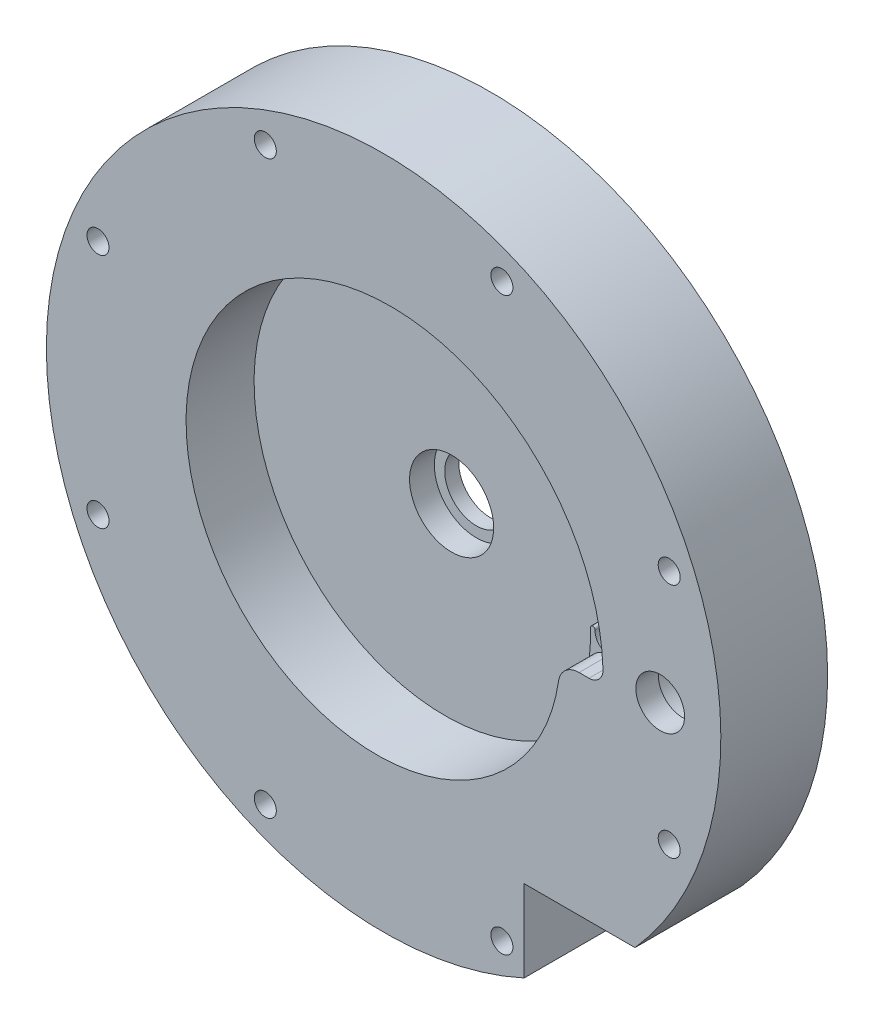
from build123d import *

# Parameters (mm, degrees)
VOLUTE_CUT_DEPTH      = 109.853225441
CAP_CUT_DEPTH         = 110.150134912
SKETCH28_W            = 25.046126628
SKETCH28_H            = 18.470321928
OUTLET_HOLE_CUT_DEPTH = 111.431593896
SKETCH26_R            = 2.4892
FASTENER_HOLE_DEPTH   = 111.431593896
FASTENER_HOLES_COUNT  = 8
CIRPATTERN1_COUNT     = 8


with BuildPart() as part:
    # Sketch22 → Main Body (revolve)
    with BuildSketch(Plane(origin=(0, 0, 0), x_dir=(1, 0, 0), z_dir=(0, 1, 0))):
        Polygon((-25.4, 0), (-9.5, 0), (-9.5, 5.588), (-7.14375, 5.588), (-7.14375, 8.763), (-76.2, 8.763), (-76.2, -15.367), (-25.4, -15.367), align=None)
    revolve(axis=Axis((0, 0, 0), (0, 0, -1)))

    # Sketch23 → Volute Cut (cut, through all)
    with BuildSketch(Plane.XY):
        with BuildLine():
            Line((44.166924028, -3.278948669), (46.409987281, -3.278948669))
            ThreePointArc((46.409987281, -3.278948669), (48.689668065, -2.311613487), (49.577995098, 0))
            add(Edge.make_bspline(
                [(39.939526111, 0), (39.942269446, -0.0837473), (39.947756723, -0.251260409), (39.954015699, -0.502616311), (39.958818633, -0.754058522), (39.965227666, -1.257271925), (39.961619732, -2.517021244), (39.875091851, -4.365243066), (39.649454652, -6.542756078), (39.33988264, -8.543760179), (38.929454388, -10.530211789), (38.418824768, -12.497026639), (37.808911738, -14.439148731), (37.100892119, -16.351564673), (36.296198826, -18.22931668), (35.396517359, -20.067515799), (34.403782101, -21.86135476), (33.320172005, -23.606120692), (32.148105775, -25.297207577), (30.890236459, -26.930128476), (29.549445458, -28.500527466), (28.128835965, -30.00419128), (26.631725823, -31.437060619), (25.061639825, -32.795241099), (23.422301466, -34.075013818), (21.717624168, -35.272845505), (19.951701985, -36.385398236), (18.128799822, -37.409538673), (16.253343185, -38.342346824), (14.329907485, -39.18112428), (12.363206918, -39.923401923), (10.358082955, -40.566947066), (8.319492465, -41.109770024), (6.2524955, -41.550130082), (4.162242776, -41.886540847), (2.053962868, -42.117774975), (-0.06705083, -42.242868254), (-2.195453363, -42.261123016), (-4.325861655, -42.172110902), (-6.452868085, -41.975674931), (-8.57105419, -41.671930888), (-10.675004435, -41.261268029), (-12.759320026, -40.744349078), (-14.818632734, -40.12210953), (-16.847618693, -39.395756259), (-18.841012126, -38.56676542), (-20.793618979, -37.636879662), (-22.700330424, -36.608104648), (-24.556136184, -35.482704889), (-26.356137661, -34.263198905), (-28.095560825, -32.952353715), (-29.769768833, -31.55317868), (-31.374274336, -30.068918699), (-32.904751456, -28.503046779), (-34.357047394, -26.859256), (-35.727193628, -25.141450883), (-37.011416693, -23.353738194), (-38.206148494, -21.500417195), (-39.308036131, -19.585969367), (-40.313951213, -17.615047632), (-41.220998633, -15.592465105), (-42.026524769, -13.523183384), (-42.728125112, -11.412300433), (-43.323651272, -9.265038062), (-43.811217363, -7.086729057), (-44.189205737, -4.882803972), (-44.45627205, -2.658777629), (-44.611349658, -0.420235354), (-44.653653307, 1.827181013), (-44.582682128, 4.077787306), (-44.398221909, 6.325871377), (-44.100346646, 8.56570756), (-43.689419363, 10.791571224), (-43.166092199, 12.997753372), (-42.531305754, 15.17857525), (-41.786287694, 17.328402935), (-40.932550626, 19.441661853), (-39.971889229, 21.5128512), (-38.906376662, 23.536558227), (-37.738360243, 25.507472342), (-36.470456415, 27.420399009), (-35.105545007, 29.270273394), (-33.646762806, 31.052173728), (-32.097496441, 32.761334351), (-30.461374618, 34.393158406), (-28.742259697, 35.943230135), (-26.94423865, 37.407326771), (-25.071613414, 38.781429964), (-23.128890663, 40.061736735), (-21.120771014, 41.244669906), (-19.052137713, 42.326888003), (-16.928044805, 43.305294581), (-14.753704833, 44.177046957), (-12.534476089, 44.939564331), (-10.275849449, 45.590535256), (-7.983434825, 46.127924454), (-5.662947262, 46.549978947), (-3.32019273, 46.855233489), (-0.961053623, 47.042515279), (1.408525976, 47.110947946), (3.782555248, 47.059954789), (6.155011749, 46.889261268), (8.519856664, 46.598896718), (10.871050148, 46.189195315), (13.202566726, 45.660796242), (15.5084107, 45.014643097), (17.782631543, 44.251982509), (20.019339221, 43.374361984), (22.21271942, 42.383626969), (24.357048618, 41.281917146), (26.446708992, 40.07166197), (28.476203094, 38.755575441), (30.440168269, 37.336650139), (32.333390787, 35.818150527), (34.150819627, 34.203605534), (35.887579905, 32.496800442), (37.53898589, 30.70176809), (39.100553583, 28.822779415), (40.568012821, 26.864333353), (41.937318874, 24.831146131), (43.204663511, 22.728139958), (44.366485495, 20.560431162), (45.419480476, 18.333317788), (46.360610274, 16.052266689), (47.187111503, 13.722900146), (47.896503526, 11.35098205), (48.486595709, 8.942403666), (48.955493971, 6.503169041), (49.272698681, 4.245159804), (49.431000562, 2.592939581), (49.496684411, 1.660906774), (49.521980456, 1.24612125), (49.539009606, 0.934823446), (49.554044624, 0.6233596), (49.56726265, 0.311747828), (49.574417371, 0.103923043), (49.577995098, 0)],
                knots=[0, 0, 0, 0, 0.000895368, 0.001790933, 0.002686696, 0.003582656, 0.00716847, 0.016146863, 0.023343889, 0.030553689, 0.037776306, 0.045011781, 0.052260149, 0.059521445, 0.0667957, 0.074082946, 0.08138321, 0.088696521, 0.096022905, 0.103362389, 0.110714996, 0.11808075, 0.125459676, 0.132851796, 0.140257131, 0.147675704, 0.155107535, 0.162552646, 0.170011055, 0.177482784, 0.184967851, 0.192466275, 0.199978075, 0.207503269, 0.215041875, 0.222593912, 0.230159396, 0.237738345, 0.245330775, 0.252936704, 0.260556148, 0.268189123, 0.275835645, 0.28349573, 0.291169394, 0.298856653, 0.306557521, 0.314272014, 0.322000147, 0.329741934, 0.337497391, 0.345266532, 0.35304937, 0.360845922, 0.368656199, 0.376480218, 0.384317991, 0.392169531, 0.400034854, 0.407913972, 0.415806898, 0.423713647, 0.43163423, 0.439568662, 0.447516954, 0.455479121, 0.463455174, 0.471445127, 0.479448991, 0.48746678, 0.495498506, 0.503544181, 0.511603818, 0.519677428, 0.527765023, 0.535866616, 0.543982219, 0.552111843, 0.5602555, 0.568413202, 0.57658496, 0.584770787, 0.592970693, 0.60118469, 0.609412789, 0.617655002, 0.625911339, 0.634181813, 0.642466433, 0.650765212, 0.65907816, 0.667405288, 0.675746607, 0.684102128, 0.692471861, 0.700855818, 0.709254008, 0.717666443, 0.726093134, 0.734534089, 0.742989321, 0.75145884, 0.759942655, 0.768440778, 0.776953218, 0.785479986, 0.794021092, 0.802576546, 0.811146358, 0.819730538, 0.828329097, 0.836942043, 0.845569388, 0.854211141, 0.862867312, 0.87153791, 0.880222946, 0.888922429, 0.89763637, 0.906364776, 0.915107659, 0.923865028, 0.932636892, 0.94142326, 0.950224144, 0.959039551, 0.967869491, 0.976713973, 0.985573008, 0.992226839, 0.994446604, 0.995556828, 0.996667279, 0.997777958, 0.998888865, 1, 1, 1, 1], degree=3))
            ThreePointArc((39.939526111, 0), (40.466576111, 0.544597432), (40.993626111, 0))
            ThreePointArc((40.993626111, 0), (41.885404576, -2.31195546), (44.166924028, -3.278948669))
        make_face()
    extrude(amount=VOLUTE_CUT_DEPTH, mode=Mode.SUBTRACT)

    # Sketch25 → Cap Cut (cut, through all)
    with BuildSketch(Plane.XY.offset(8.58266)):
        with BuildLine():
            ThreePointArc((39.530232145, -7.279976568), (41.104770543, -4.417482526), (44.166924028, -3.278948669))
            ThreePointArc((44.166924028, -3.278948669), (41.885404576, -2.31195546), (40.993626111, 0))
            ThreePointArc((40.993626111, 0), (40.466576111, 0.544597432), (39.939526111, 0))
            add(Edge.make_bspline(
                [(39.530232145, -7.279976568), (39.566715351, -7.033442985), (39.69332497, -6.119385335), (39.875091851, -4.365243066), (39.961619732, -2.517021244), (39.965227666, -1.257271925), (39.958818633, -0.754058522), (39.954015699, -0.502616311), (39.947756723, -0.251260409), (39.942269446, -0.0837473), (39.939526111, 0)],
                knots=[0.973993066, 0.973993066, 0.973993066, 0.973993066, 0.976656111, 0.983853137, 0.99283153, 0.996417344, 0.997313304, 0.998209067, 0.999104632, 1, 1, 1, 1], degree=3))
        make_face()
    extrude(amount=CAP_CUT_DEPTH, mode=Mode.SUBTRACT)

    # Sketch28 → Outlet Hole Cut (cut, through all)
    with BuildSketch(Plane.XY.offset(15.367)):
        with Locations((44.273063314, -60.035160964)):
            Rectangle(SKETCH28_W, SKETCH28_H)
    extrude(amount=-OUTLET_HOLE_CUT_DEPTH, mode=Mode.SUBTRACT)

    # Sketch26 → Fastener Hole (cut, through all)
    with BuildSketch(Plane.XY.offset(15.367)):
        with Locations((64.532985346, -26.730437751)):
            Circle(SKETCH26_R)
    fastener_hole = extrude(amount=-FASTENER_HOLE_DEPTH, mode=Mode.SUBTRACT)

    # Fastener Holes: Fastener Hole ×8 about axis
    fastener_holes_axis = Axis((0, 0, 0), (0, 0, 1))
    for i in range(1, FASTENER_HOLES_COUNT):
        add(fastener_hole.rotate(fastener_holes_axis, i * 360 / FASTENER_HOLES_COUNT), mode=Mode.SUBTRACT)

    # Sketch27 → Turbine Shaft Hole (revolve, cut)
    with BuildSketch(Plane.ZX):
        Polygon((15.367, 62.5), (-8.763, 62.5), (-8.763, 51.324), (3.937, 51.324), (3.937, 54.5625), (10.287, 54.5625), (10.287, 57), (15.367, 57), align=None)
    revolve(axis=Axis((62.5, 0, 15.367), (0, 0, -1)), mode=Mode.SUBTRACT)

    # Sketch30 → Tap Drill for #10-32 Tap1 (revolve, cut)
    with BuildSketch(Plane(origin=(52.799715283, 21.87035816, -8.763), x_dir=(0, 1, 0), z_dir=(1, 0, 0))):
        Polygon((0, 0), (0, 13.913317848), (2.0193, 12.7), (2.0193, 0), align=None)
    tap_drill_for_10_32_tap1 = revolve(axis=Axis((52.799715283, 21.87035816, -15.113), (0, 0, 1)), mode=Mode.SUBTRACT)

    # CirPattern1: Tap Drill for #10-32 Tap1 ×8 about axis
    cirpattern1_axis = Axis((0, 0, 0), (0, 0, 1))
    for i in range(1, CIRPATTERN1_COUNT):
        add(tap_drill_for_10_32_tap1.rotate(cirpattern1_axis, i * 360 / CIRPATTERN1_COUNT), mode=Mode.SUBTRACT)


solid = part.part
